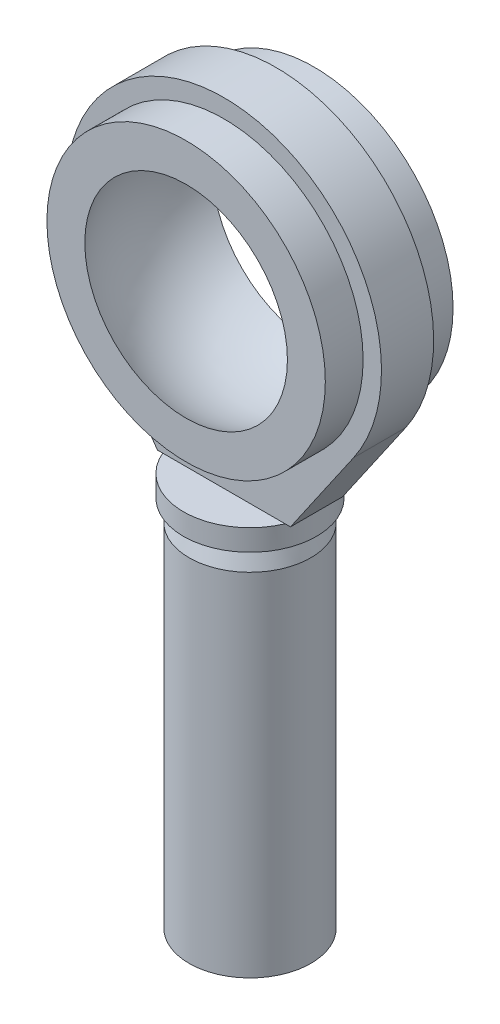
from build123d import *

# Parameters (mm, degrees)
SKETCH_1_R      = 13.075
EXTRUDE_1_DEPTH = 6
SKETCH_1_4_R    = 13.075
EXTRUDE_2_DEPTH = 2.45
SKETCH_3_R      = 6.25
EXTRUDE_5_DEPTH = 2
EXTRUDE_6_DEPTH = 2.45


with BuildPart() as part:
    # 스케치1 → 보스-돌출1 (new, symmetric)
    with BuildSketch(Plane.XY):
        Circle(SKETCH_1_R)
    extrude(amount=EXTRUDE_1_DEPTH, both=True)

    # 스케치1<4> → 보스-돌출2 (add, symmetric)
    with BuildSketch(Plane.XY):
        with BuildLine():
            ThreePointArc((14.8, 0), (0, 14.8), (-14.8, 0))
            ThreePointArc((-14.8, 0), (0, -14.8), (14.8, 0))
        make_face()
        Circle(SKETCH_1_4_R, mode=Mode.SUBTRACT)
    extrude(amount=EXTRUDE_2_DEPTH, both=True)

    # 스케치6 → 컷-회전6 (revolve, cut)
    with BuildSketch(Plane(origin=(0, 0, 0), x_dir=(0, 0, -1), z_dir=(1, 0, 0))):
        with BuildLine():
            Line((-11.25, 0), (11.25, 0))
            ThreePointArc((11.25, 0), (0, 11.25), (-11.25, 0))
        make_face()
    revolve(axis=Axis((0, 0, -11.25), (0, 0, 1)), mode=Mode.SUBTRACT)



with BuildPart() as body_2:
    # 스케치3 → 보스-돌출5 (new body)
    with BuildSketch(Plane(origin=(0, -19, 0), x_dir=(1, 0, 0), z_dir=(0, 1, 0))):
        Circle(SKETCH_3_R)
    extrude(amount=EXTRUDE_5_DEPTH)


with BuildPart() as body_3:
    # 스케치4 → 회전1 (revolve)
    with BuildSketch(Plane.XY):
        Polygon((0, -19), (5.05, -19), (5.725, -21), (5.725, -54), (0, -54), align=None)
    revolve(axis=Axis((0, -19, 0), (0, -1, 0)))


with BuildPart() as part_1:
    add(part.part)

    add(body_2.part)  # 보스-돌출6 merges body 2
    # 스케치7 → 보스-돌출6 (add, symmetric)
    with BuildSketch(Plane.XY):
        with BuildLine():
            Line((6.25, -17), (-6.25, -17))
            Line((-6.25, -17), (-12.180764996, -8.406483457))
            ThreePointArc((-12.180764996, -8.406483457), (0, -14.8), (12.180764996, -8.406483457))
            Line((12.180764996, -8.406483457), (6.25, -17))
        make_face()
    extrude(amount=EXTRUDE_6_DEPTH, both=True)


solid = Compound([body_3.part, part_1.part])
